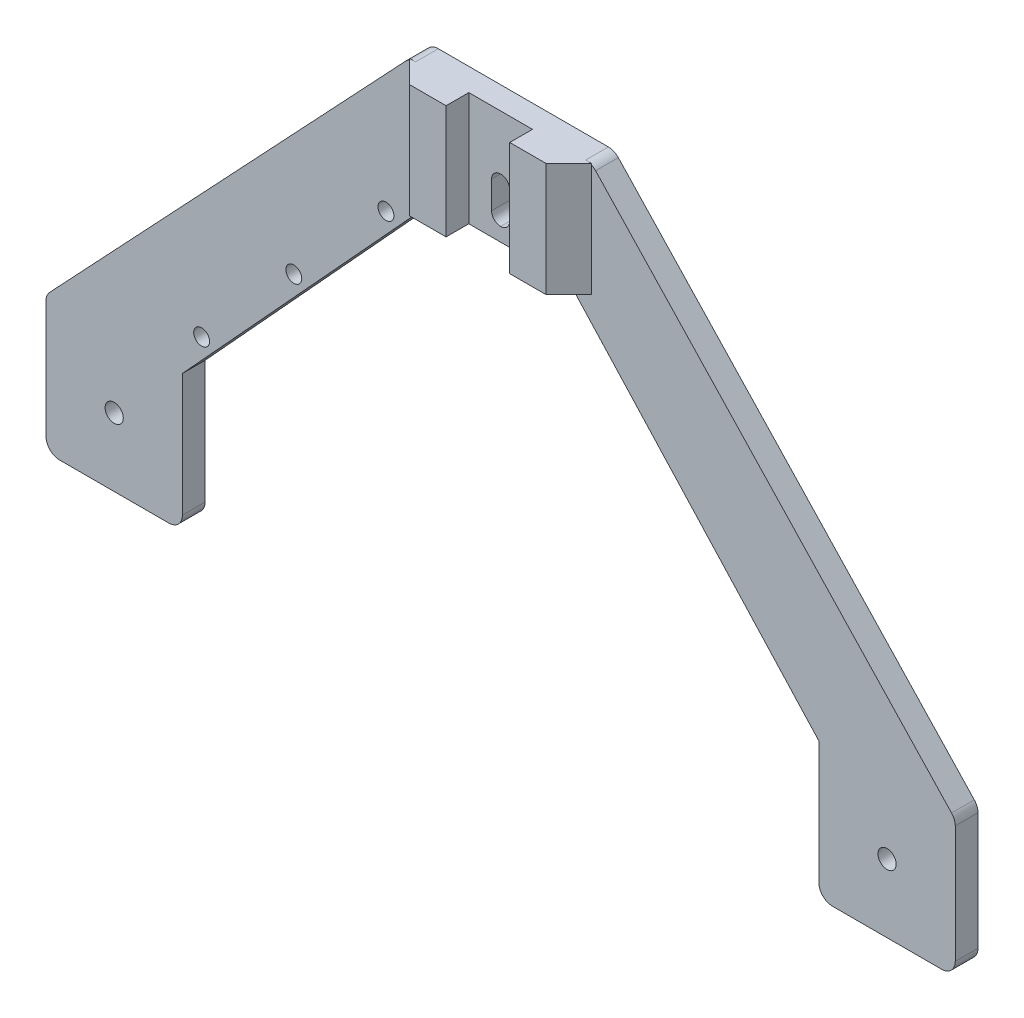
from build123d import *

# Parameters (mm, degrees)
DODANIE_WYCI_GNI_CIE1_DEPTH = 5
SZKIC3_R                    = 2
WYTNIJ_WYCI_GNI_CIE1_DEPTH  = 5
SZKIC4_W                    = 4
SZKIC4_H                    = 10
WYTNIJ_WYCI_GNI_CIE2_DEPTH  = 5
ZAOKR_GLENIE1_R             = 3
ZAOKR_GLENIE2_R             = 2
SZKIC5_W                    = 13
SZKIC5_H                    = 25
DODANIE_WYCI_GNI_CIE2_DEPTH = 5
SFAZOWANIE1_SIZE            = 5
WYTNIJ_WYCI_GNI_CIE3_REACH  = 232.76
SZKIC6_R                    = 1.75


with BuildPart() as part:
    # Szkic2 → Dodanie-wyciągnięcie1 (new body)
    with BuildSketch(Plane.XY):
        Polygon((0, 0), (30, 0), (30, 30), (85, 90), (115, 90), (170, 30), (170, 0), (200, 0), (200, 30), (120, 115), (80, 115), (0, 30), align=None)
    extrude(amount=DODANIE_WYCI_GNI_CIE1_DEPTH)

    # Szkic3 → Wytnij-wyciągnięcie1 (cut)
    with BuildSketch(Plane.XY.offset(5)):
        with Locations((15, 15)):
            Circle(SZKIC3_R)
        with Locations((185, 15)):
            Circle(SZKIC3_R)
    extrude(amount=-WYTNIJ_WYCI_GNI_CIE1_DEPTH, mode=Mode.SUBTRACT)

    # Szkic4 → Wytnij-wyciągnięcie2 (cut)
    with BuildSketch(Plane.XY.offset(5)):
        with Locations((100, 98)):
            Rectangle(SZKIC4_W, SZKIC4_H)
    extrude(amount=-WYTNIJ_WYCI_GNI_CIE2_DEPTH, mode=Mode.SUBTRACT)

    # Zaokrąglenie1
    zaokr_glenie1_edges = [part.edges().sort_by_distance(p)[0] for p in [
        (0, 30, 2.5),
        (80, 115, 2.5),
        (120, 115, 2.5),
        (200, 30, 2.5),
        (200, 0, 2.5),
        (170, 0, 2.5),
        (30, 0, 2.5),
        (0, 0, 2.5),
    ]]
    fillet(zaokr_glenie1_edges, radius=ZAOKR_GLENIE1_R)

    # Zaokrąglenie2
    zaokr_glenie2_edges = [part.edges().sort_by_distance(p)[0] for p in [
        (98, 103, 2.5),
        (102, 103, 2.5),
        (102, 93, 2.5),
        (98, 93, 2.5),
    ]]
    fillet(zaokr_glenie2_edges, radius=ZAOKR_GLENIE2_R - 0.0001)  # a hair under: the kernel refuses the full size

    # Szkic5 → Dodanie-wyciągnięcie2 (add)
    with BuildSketch(Plane.XY.offset(5)):
        with Locations((113.5, 102.5)):
            Rectangle(SZKIC5_W, SZKIC5_H)
        with Locations((86.5, 102.5)):
            Rectangle(SZKIC5_W, SZKIC5_H)
    extrude(amount=DODANIE_WYCI_GNI_CIE2_DEPTH)

    # Sfazowanie1
    sfazowanie1_edges = [part.edges().sort_by_distance(p)[0] for p in [
        (80, 102.5, 10),
        (120, 102.5, 10),
    ]]
    chamfer(sfazowanie1_edges, length=SFAZOWANIE1_SIZE - 0.0001)  # a hair under: the kernel refuses the full size

    # Szkic6 → Wytnij-wyciągnięcie3 (cut, up to next)
    with BuildSketch(Plane.XY.offset(5), mode=Mode.PRIVATE) as wytnij_wyci_gni_cie3_sk1:
        with Locations((74.778017415, 83.288424616)):
            Circle(SZKIC6_R)
    wytnij_wyci_gni_cie3_tool1 = extrude(wytnij_wyci_gni_cie3_sk1.sketch, amount=-WYTNIJ_WYCI_GNI_CIE3_REACH, mode=Mode.PRIVATE) & part.part
    # Szkic6 → Wytnij-wyciągnięcie3 (cut, up to next)
    with BuildSketch(Plane.XY.offset(5), mode=Mode.PRIVATE) as wytnij_wyci_gni_cie3_sk2:
        with Locations((34.234539704, 39.059176204)):
            Circle(SZKIC6_R)
    wytnij_wyci_gni_cie3_tool2 = extrude(wytnij_wyci_gni_cie3_sk2.sketch, amount=-WYTNIJ_WYCI_GNI_CIE3_REACH, mode=Mode.PRIVATE) & part.part
    # Szkic6 → Wytnij-wyciągnięcie3 (cut, up to next)
    with BuildSketch(Plane.XY.offset(5), mode=Mode.PRIVATE) as wytnij_wyci_gni_cie3_sk3:
        with Locations((54.50627856, 61.17380041)):
            Circle(SZKIC6_R)
    wytnij_wyci_gni_cie3_tool3 = extrude(wytnij_wyci_gni_cie3_sk3.sketch, amount=-WYTNIJ_WYCI_GNI_CIE3_REACH, mode=Mode.PRIVATE) & part.part
    add(wytnij_wyci_gni_cie3_tool1.solids().sort_by_distance((74.778017, 83.288425, 5))[0], mode=Mode.SUBTRACT)
    add(wytnij_wyci_gni_cie3_tool2.solids().sort_by_distance((34.23454, 39.059176, 5))[0], mode=Mode.SUBTRACT)
    add(wytnij_wyci_gni_cie3_tool3.solids().sort_by_distance((54.506279, 61.1738, 5))[0], mode=Mode.SUBTRACT)


solid = part.part
